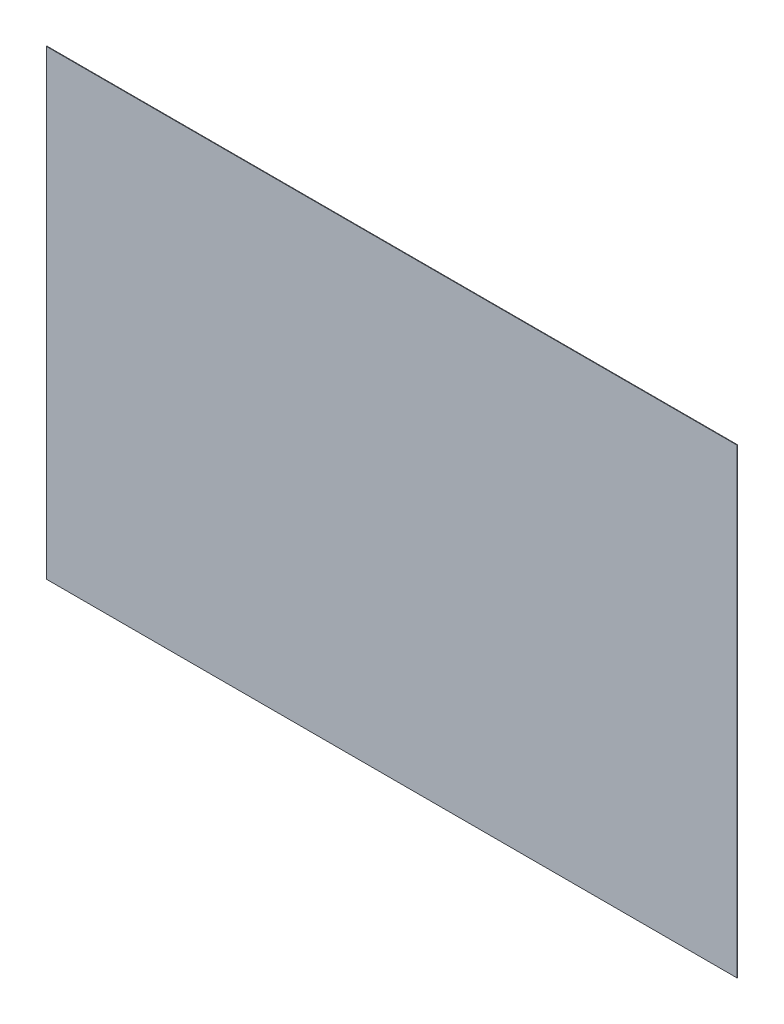
from build123d import *

# Parameters (mm, degrees)
SKETCH1_W           = 2500
SKETCH1_H           = 1670
BOSS_EXTRUDE1_DEPTH = 2


with BuildPart() as part:
    # Sketch1 → Boss-Extrude1 (new body)
    with BuildSketch(Plane.XY):
        with Locations((1250, 835)):
            Rectangle(SKETCH1_W, SKETCH1_H)
    extrude(amount=BOSS_EXTRUDE1_DEPTH)


solid = part.part
